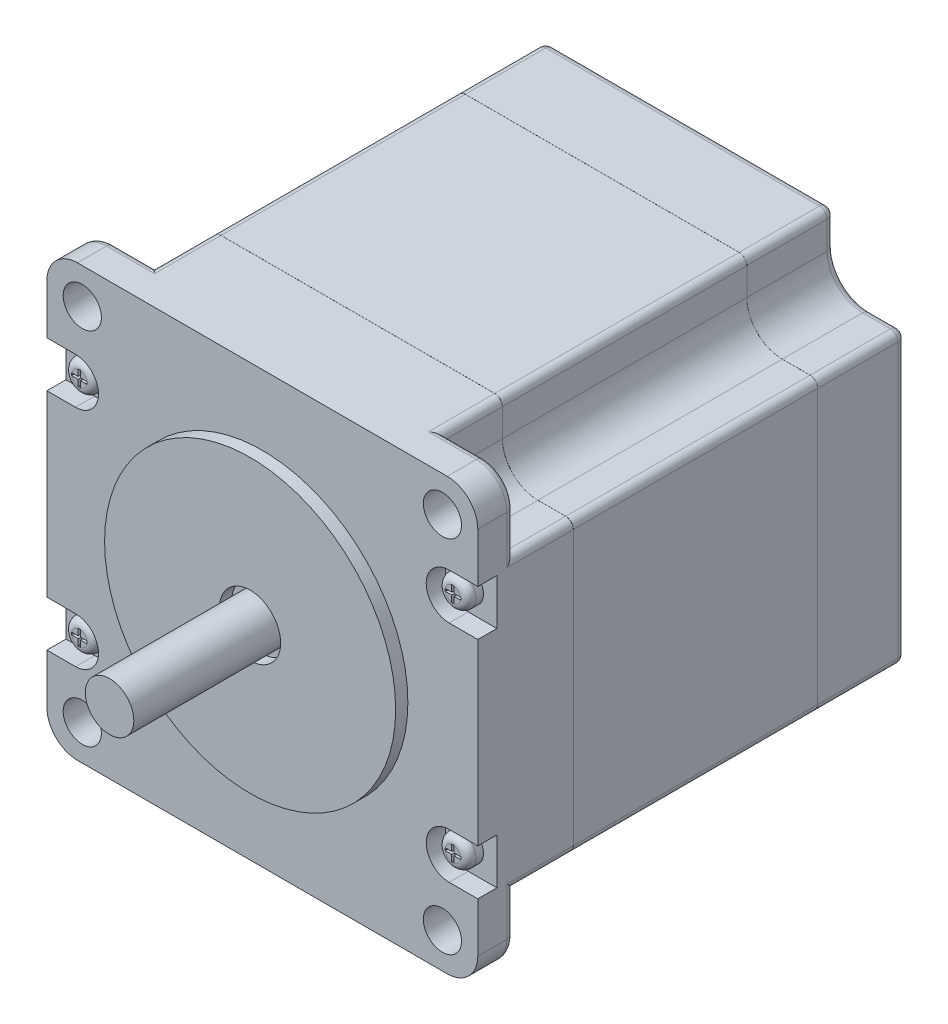
from build123d import *

# Parameters (mm, degrees)
SKETCH1_W             = 56.4
SKETCH1_H             = 56.4
BOSS_EXTRUDE1_DEPTH   = 56
SKETCH2_R             = 19.05
BOSS_EXTRUDE2_DEPTH   = 1.6
SKETCH3_R             = 2.5
CUT_EXTRUDE1_DEPTH    = 10
CUT_EXTRUDE2_DEPTH    = 51.2
FILLET1_R             = 4
SKETCH7_W             = 32
SKETCH7_H             = 56.42
SKETCH7_W_2           = 31.98
SKETCH7_H_2           = 56.4
CUT_EXTRUDE3_DEPTH    = 85.333860341
SKETCH8_R             = 6
CUT_EXTRUDE4_DEPTH    = 3
SKETCH9_R             = 3.175
BOSS_EXTRUDE3_DEPTH   = 1.5
CHAMFER1_SIZE         = 0.5
SKETCH10_R            = 4
CUT_EXTRUDE5_DEPTH    = 1.6
SKETCH11_R            = 3.175
BOSS_EXTRUDE4_DEPTH   = 20
CUT_EXTRUDE7_DEPTH    = 2.5
SKETCH14_R            = 2
BOSS_EXTRUDE5_DEPTH   = 2
BOSS_EXTRUDE5_2_DEPTH = 2
BOSS_EXTRUDE5_3_DEPTH = 2
BOSS_EXTRUDE5_4_DEPTH = 2
FILLET2_R             = 1
FILLET3_R             = 1
FILLET4_R             = 1
FILLET5_R             = 1
CUT_EXTRUDE8_DEPTH    = 1.2
CHAMFER2_SIZE         = 1
CHAMFER3_SIZE         = 1
CHAMFER4_SIZE         = 1
CHAMFER5_SIZE         = 1
FILLET6_R             = 1
FILLET7_R             = 1
FILLET8_R             = 1


with BuildPart() as part:
    # Sketch1 → Boss-Extrude1 (new body)
    with BuildSketch(Plane.XY):
        Rectangle(SKETCH1_W, SKETCH1_H)
    extrude(amount=-BOSS_EXTRUDE1_DEPTH)

    # Sketch2 → Boss-Extrude2 (add)
    with BuildSketch(Plane.XY):
        with Locations(Location((0, 0, 0), (0, 0, 180))):
            Circle(SKETCH2_R)
    extrude(amount=BOSS_EXTRUDE2_DEPTH)

    # Sketch3 → Cut-Extrude1 (cut)
    with BuildSketch(Plane.XY):
        with Locations((-23.57, 23.57)):
            Circle(SKETCH3_R)
        with Locations((23.57, 23.57)):
            Circle(SKETCH3_R)
        with Locations((23.57, -23.57)):
            Circle(SKETCH3_R)
        with Locations((-23.57, -23.57)):
            Circle(SKETCH3_R)
    extrude(amount=-CUT_EXTRUDE1_DEPTH, mode=Mode.SUBTRACT)

    # Sketch6 → Cut-Extrude2 (cut)
    with BuildSketch(Plane(origin=(0, 0, -56), x_dir=(-1, 0, 0), z_dir=(0, 0, -1))):
        with BuildLine():
            Line((-18.92, 23.57), (-18.92, 28.2))
            Line((-18.92, 28.2), (-28.2, 28.2))
            Line((-28.2, 28.2), (-28.2, 18.92))
            Line((-28.2, 18.92), (-23.57, 18.92))
            ThreePointArc((-23.57, 18.92), (-20.281953467, 20.281953467), (-18.92, 23.57))
        make_face()
        with BuildLine():
            Line((28.2, 28.2), (28.2, 18.92))
            Line((28.2, 18.92), (23.57, 18.92))
            ThreePointArc((23.57, 18.92), (20.281953467, 20.281953467), (18.92, 23.57))
            Line((18.92, 23.57), (18.92, 28.2))
            Line((18.92, 28.2), (28.2, 28.2))
        make_face()
        with BuildLine():
            Line((-28.2, -28.2), (-28.2, -18.92))
            Line((-28.2, -18.92), (-23.57, -18.92))
            ThreePointArc((-23.57, -18.92), (-20.281953467, -20.281953467), (-18.92, -23.57))
            Line((-18.92, -23.57), (-18.92, -28.2))
            Line((-18.92, -28.2), (-28.2, -28.2))
        make_face()
        with BuildLine():
            Line((18.92, -23.57), (18.92, -28.2))
            Line((18.92, -28.2), (28.2, -28.2))
            Line((28.2, -28.2), (28.2, -18.92))
            Line((28.2, -18.92), (23.57, -18.92))
            ThreePointArc((23.57, -18.92), (20.281953467, -20.281953467), (18.92, -23.57))
        make_face()
    extrude(amount=-CUT_EXTRUDE2_DEPTH, mode=Mode.SUBTRACT)

    # Fillet1
    fillet1_edges = [part.edges().sort_by_distance(p)[0] for p in [
        (-28.2, 28.2, -2.4),
        (28.2, 28.2, -2.4),
        (28.2, -28.2, -2.4),
        (-28.2, -28.2, -2.4),
    ]]
    fillet(fillet1_edges, radius=FILLET1_R)

    # Sketch7 → Cut-Extrude3 (cut, through all)
    with BuildSketch(Plane.ZY.offset(28.2)):
        with Locations((-28.5, 0)):
            Rectangle(SKETCH7_W, SKETCH7_H)
        with Locations((-28.5, 0)):
            Rectangle(SKETCH7_W_2, SKETCH7_H_2, mode=Mode.SUBTRACT)
    extrude(amount=-CUT_EXTRUDE3_DEPTH, mode=Mode.SUBTRACT)


with BuildPart() as cut_extrude3_piece_1:
    # of the separate pieces the step leaves, piece 1, a body of its own (cut_extrude3_pieces)
    add(part.part.solids().sort_by_distance((-18.92, -28.2, -12.51))[0])

    # Fillet7
    fillet7_edges = [cut_extrude3_piece_1.edges().sort_by_distance(p)[0] for p in [
        (-28.2, -18.92, -28.5),
        (-18.92, 28.2, -28.5),
        (28.2, 18.92, -28.5),
        (18.92, 28.2, -28.5),
        (-28.2, 18.92, -28.5),
        (-18.92, -28.2, -28.5),
        (28.2, -18.92, -28.5),
        (18.92, -28.2, -28.5),
    ]]
    fillet(fillet7_edges, radius=FILLET7_R)


with BuildPart() as cut_extrude3_piece_2:
    # of the separate pieces the step leaves, piece 2, a body of its own (cut_extrude3_pieces)
    add(part.part.solids().sort_by_distance((-24.2, -28.2, 0))[0])

    # Sketch10 → Cut-Extrude5 (cut)
    with BuildSketch(Plane.XY.offset(1.6)):
        Circle(SKETCH10_R)
    extrude(amount=-CUT_EXTRUDE5_DEPTH, mode=Mode.SUBTRACT)

    # Sketch13 → Cut-Extrude7 (cut)
    with BuildSketch(Plane.XY):
        with BuildLine():
            Line((-24.45, 17.7), (-28.2, 17.7))
            Line((-28.2, 17.7), (-28.2, 11.7))
            Line((-28.2, 11.7), (-24.45, 11.7))
            ThreePointArc((-24.45, 11.7), (-21.45, 14.7), (-24.45, 17.7))
        make_face()
        with BuildLine():
            Line((28.2, 11.7), (24.45, 11.7))
            ThreePointArc((24.45, 11.7), (21.45, 14.7), (24.45, 17.7))
            Line((24.45, 17.7), (28.2, 17.7))
            Line((28.2, 17.7), (28.2, 11.7))
        make_face()
        with BuildLine():
            Line((24.45, -17.7), (28.2, -17.7))
            Line((28.2, -17.7), (28.2, -11.7))
            Line((28.2, -11.7), (24.45, -11.7))
            ThreePointArc((24.45, -11.7), (21.45, -14.7), (24.45, -17.7))
        make_face()
        with BuildLine():
            Line((-28.2, -11.7), (-24.45, -11.7))
            ThreePointArc((-24.45, -11.7), (-21.45, -14.7), (-24.45, -17.7))
            Line((-24.45, -17.7), (-28.2, -17.7))
            Line((-28.2, -17.7), (-28.2, -11.7))
        make_face()
    extrude(amount=-CUT_EXTRUDE7_DEPTH, mode=Mode.SUBTRACT)

    # Fillet8
    fillet8_edges = [cut_extrude3_piece_2.edges().sort_by_distance(p)[0] for p in [
        (28.2, 21.56, -4.8),
        (28.2, -21.56, -4.8),
        (28.2, -18.92, -8.65),
        (21.56, -28.2, -4.8),
        (-21.56, -28.2, -4.8),
        (-18.92, -28.2, -8.65),
        (-28.2, -21.56, -4.8),
        (-28.2, 21.56, -4.8),
        (-28.2, 18.92, -8.65),
        (-21.56, 28.2, -4.8),
        (21.56, 28.2, -4.8),
        (18.92, 28.2, -8.65),
        (-27.028427125, 27.028427125, -4.8),
        (-18.92, 28.2, -8.65),
        (27.028427125, 27.028427125, -4.8),
        (28.2, 18.92, -8.65),
        (27.028427125, -27.028427125, -4.8),
        (18.92, -28.2, -8.65),
        (-27.028427125, -27.028427125, -4.8),
        (-28.2, -18.92, -8.65),
    ]]
    fillet(fillet8_edges, radius=FILLET8_R)


with BuildPart() as cut_extrude3_piece_3:
    # of the separate pieces the step leaves, piece 3, a body of its own (cut_extrude3_pieces)
    add(part.part.solids().sort_by_distance((18.92, -28.2, -44.5))[0])

    # Sketch8 → Cut-Extrude4 (cut)
    with BuildSketch(Plane(origin=(0, 0, -56), x_dir=(-1, 0, 0), z_dir=(0, 0, -1))):
        Circle(SKETCH8_R)
    extrude(amount=-CUT_EXTRUDE4_DEPTH, mode=Mode.SUBTRACT)

    # Fillet6
    fillet6_edges = [cut_extrude3_piece_3.edges().sort_by_distance(p)[0] for p in [
        (-18.92, -28.2, -50.25),
        (-28.2, -18.92, -50.25),
        (28.2, -18.92, -50.25),
        (18.92, -28.2, -50.25),
        (18.92, 28.2, -50.25),
        (28.2, 18.92, -50.25),
        (-28.2, 18.92, -50.25),
        (-18.92, 28.2, -50.25),
        (6, 0, -56),
        (-28.2, 0, -56),
        (-20.281953467, 20.281953467, -56),
        (-25.885, 18.92, -56),
        (-18.92, 25.885, -56),
        (0, 28.2, -56),
        (20.281953467, 20.281953467, -56),
        (18.92, 25.885, -56),
        (25.885, 18.92, -56),
        (28.2, 0, -56),
        (20.281953467, -20.281953467, -56),
        (25.885, -18.92, -56),
        (18.92, -25.885, -56),
        (0, -28.2, -56),
        (-20.281953467, -20.281953467, -56),
        (-18.92, -25.885, -56),
        (-25.885, -18.92, -56),
    ]]
    fillet(fillet6_edges, radius=FILLET6_R)


with BuildPart() as body_4:
    # Sketch9 → Boss-Extrude3 (new body)
    with BuildSketch(Plane(origin=(0, 0, -53), x_dir=(-1, 0, 0), z_dir=(0, 0, -1))):
        Circle(SKETCH9_R)
    extrude(amount=BOSS_EXTRUDE3_DEPTH)

    # Chamfer1
    chamfer1_edges = [body_4.edges().sort_by_distance(p)[0] for p in [
        (3.175, 0, -54.5),
    ]]
    chamfer(chamfer1_edges, length=CHAMFER1_SIZE)


with BuildPart() as body_5:
    # Sketch11 → Boss-Extrude4 (new body)
    with BuildSketch(Plane.XY):
        Circle(SKETCH11_R)
    extrude(amount=BOSS_EXTRUDE4_DEPTH)


with BuildPart() as body_6:
    # Sketch14 → Boss-Extrude5 (new body)
    with BuildSketch(Plane.XY.offset(-2.5)):
        with Locations((-24.45, 14.7)):
            Circle(SKETCH14_R)
    extrude(amount=BOSS_EXTRUDE5_DEPTH)

    # Fillet2
    fillet2_edges = [body_6.edges().sort_by_distance(p)[0] for p in [
        (-26.45, 14.7, -0.5),
    ]]
    fillet(fillet2_edges, radius=FILLET2_R)


with BuildPart() as body_7:
    # Sketch14 → Boss-Extrude5 2 (new body)
    with BuildSketch(Plane.XY.offset(-2.5)):
        with Locations((24.45, 14.7)):
            Circle(SKETCH14_R)
    extrude(amount=BOSS_EXTRUDE5_2_DEPTH)

    # Fillet5
    fillet5_edges = [body_7.edges().sort_by_distance(p)[0] for p in [
        (22.45, 14.7, -0.5),
    ]]
    fillet(fillet5_edges, radius=FILLET5_R)


with BuildPart() as body_8:
    # Sketch14 → Boss-Extrude5 3 (new body)
    with BuildSketch(Plane.XY.offset(-2.5)):
        with Locations((24.45, -14.7)):
            Circle(SKETCH14_R)
    extrude(amount=BOSS_EXTRUDE5_3_DEPTH)

    # Fillet4
    fillet4_edges = [body_8.edges().sort_by_distance(p)[0] for p in [
        (22.45, -14.7, -0.5),
    ]]
    fillet(fillet4_edges, radius=FILLET4_R)


with BuildPart() as body_9:
    # Sketch14 → Boss-Extrude5 4 (new body)
    with BuildSketch(Plane.XY.offset(-2.5)):
        with Locations((-24.45, -14.7)):
            Circle(SKETCH14_R)
    extrude(amount=BOSS_EXTRUDE5_4_DEPTH)

    # Fillet3
    fillet3_edges = [body_9.edges().sort_by_distance(p)[0] for p in [
        (-26.45, -14.7, -0.5),
    ]]
    fillet(fillet3_edges, radius=FILLET3_R)


with BuildPart() as cut_extrude8_tool:
    # Sketch15 → Cut-Extrude8 (new body)
    with BuildSketch(Plane.XY.offset(-0.5)):
        Polygon((-24.612256033, 14.862256033), (-24.612256033, 15.718223761), (-24.287743967, 15.718223761), (-24.287743967, 14.862256033), (-23.426787895, 14.862256033), (-23.426787895, 14.537743967), (-24.287743967, 14.537743967), (-24.287743967, 13.681776239), (-24.612256033, 13.681776239), (-24.612256033, 14.537743967), (-25.473212105, 14.537743967), (-25.473212105, 14.862256033), align=None)
        Polygon((24.287743967, 14.862256033), (24.287743967, 15.718223761), (24.612256033, 15.718223761), (24.612256033, 14.862256033), (25.473212105, 14.862256033), (25.473212105, 14.537743967), (24.612256033, 14.537743967), (24.612256033, 13.681776239), (24.287743967, 13.681776239), (24.287743967, 14.537743967), (23.426787895, 14.537743967), (23.426787895, 14.862256033), align=None)
        Polygon((24.612256033, -14.862256033), (24.612256033, -15.718223761), (24.287743967, -15.718223761), (24.287743967, -14.862256033), (23.426787895, -14.862256033), (23.426787895, -14.537743967), (24.287743967, -14.537743967), (24.287743967, -13.681776239), (24.612256033, -13.681776239), (24.612256033, -14.537743967), (25.473212105, -14.537743967), (25.473212105, -14.862256033), align=None)
        Polygon((-24.287743967, -14.862256033), (-24.287743967, -15.718223761), (-24.612256033, -15.718223761), (-24.612256033, -14.862256033), (-25.473212105, -14.862256033), (-25.473212105, -14.537743967), (-24.612256033, -14.537743967), (-24.612256033, -13.681776239), (-24.287743967, -13.681776239), (-24.287743967, -14.537743967), (-23.426787895, -14.537743967), (-23.426787895, -14.862256033), align=None)
    extrude(amount=-CUT_EXTRUDE8_DEPTH)


with BuildPart() as body_6_1:
    add(body_6.part)

    # Cut-Extrude8: cut by cut_extrude8_tool
    add(cut_extrude8_tool.part, mode=Mode.SUBTRACT)

    # Chamfer2
    # the kernel refuses this chamfer: 1 mm, written as the material it adds along each edge
    with BuildSketch(Plane(origin=(-21.716060979, 13.681776239, -1.7), x_dir=(0, -0.027495876610585623, 0.9996219169112968), z_dir=(-1, 0, 0))) as chamfer2_piece_1_section:
        Polygon((CHAMFER2_SIZE * 0.999621916911, CHAMFER2_SIZE * 0.0274958766106), (-CHAMFER2_SIZE * 0.0274958766106, CHAMFER2_SIZE * 0.999621916911), (0, 0), align=None)
    chamfer2_piece_1 = extrude(amount=5.467878041, mode=Mode.PRIVATE)
    chamfer2_piece_1 = split(chamfer2_piece_1, bisect_by=Plane(origin=(-23.426787895, 14.585754725, -1.651989243), z_dir=(-1, 0, 0)), keep=Keep.TOP, mode=Mode.PRIVATE)
    chamfer2_piece_1 = split(chamfer2_piece_1, bisect_by=Plane(origin=(-25.473212105, 14.585754725, -1.651989243), z_dir=(1, 0, 0)), keep=Keep.TOP, mode=Mode.PRIVATE)
    add(chamfer2_piece_1)
    with BuildSketch(Plane(origin=(-23.426787895, 17.433939021, -1.7), x_dir=(0.027495876610585623, 0, 0.9996219169112968), z_dir=(0, -1, 0))) as chamfer2_piece_2_section:
        Polygon((CHAMFER2_SIZE * 0.999621916911, CHAMFER2_SIZE * 0.0274958766106), (-CHAMFER2_SIZE * 0.0274958766106, CHAMFER2_SIZE * 0.999621916911), (0, 0), align=None)
    chamfer2_piece_2 = extrude(amount=5.467878041, mode=Mode.PRIVATE)
    chamfer2_piece_2 = split(chamfer2_piece_2, bisect_by=Plane(origin=(-24.334091943, 15.718223761, -1.653652024), z_dir=(0, -1, 0)), keep=Keep.TOP, mode=Mode.PRIVATE)
    chamfer2_piece_2 = split(chamfer2_piece_2, bisect_by=Plane(origin=(-24.334091943, 13.681776239, -1.653652024), z_dir=(0, 1, 0)), keep=Keep.TOP, mode=Mode.PRIVATE)
    add(chamfer2_piece_2)
    with BuildSketch(Plane(origin=(-25.473212105, 11.966060979, -1.7), x_dir=(-0.027495876610585623, 0, 0.9996219169112968), z_dir=(0, 1, 0))) as chamfer2_piece_3_section:
        Polygon((CHAMFER2_SIZE * 0.999621916911, CHAMFER2_SIZE * 0.0274958766106), (-CHAMFER2_SIZE * 0.0274958766106, CHAMFER2_SIZE * 0.999621916911), (0, 0), align=None)
    chamfer2_piece_3 = extrude(amount=5.467878041, mode=Mode.PRIVATE)
    chamfer2_piece_3 = split(chamfer2_piece_3, bisect_by=Plane(origin=(-24.565908057, 15.718223761, -1.653652024), z_dir=(0, -1, 0)), keep=Keep.TOP, mode=Mode.PRIVATE)
    chamfer2_piece_3 = split(chamfer2_piece_3, bisect_by=Plane(origin=(-24.565908057, 13.681776239, -1.653652024), z_dir=(0, 1, 0)), keep=Keep.TOP, mode=Mode.PRIVATE)
    add(chamfer2_piece_3)
    with BuildSketch(Plane(origin=(-27.183939021, 15.718223761, -1.7), x_dir=(0, 0.027495876610585623, 0.9996219169112968), z_dir=(1, 0, 0))) as chamfer2_piece_4_section:
        Polygon((CHAMFER2_SIZE * 0.999621916911, CHAMFER2_SIZE * 0.0274958766106), (-CHAMFER2_SIZE * 0.0274958766106, CHAMFER2_SIZE * 0.999621916911), (0, 0), align=None)
    chamfer2_piece_4 = extrude(amount=5.467878041, mode=Mode.PRIVATE)
    chamfer2_piece_4 = split(chamfer2_piece_4, bisect_by=Plane(origin=(-23.426787895, 14.814245275, -1.651989243), z_dir=(-1, 0, 0)), keep=Keep.TOP, mode=Mode.PRIVATE)
    chamfer2_piece_4 = split(chamfer2_piece_4, bisect_by=Plane(origin=(-25.473212105, 14.814245275, -1.651989243), z_dir=(1, 0, 0)), keep=Keep.TOP, mode=Mode.PRIVATE)
    add(chamfer2_piece_4)


with BuildPart() as body_7_1:
    add(body_7.part)

    # Cut-Extrude8: cut by cut_extrude8_tool
    add(cut_extrude8_tool.part, mode=Mode.SUBTRACT)

    # Chamfer3
    # the kernel refuses this chamfer: 1 mm, written as the material it adds along each edge
    with BuildSketch(Plane(origin=(25.473212105, 17.433939021, -1.7), x_dir=(0.027495876610585623, 0, 0.9996219169112968), z_dir=(0, -1, 0))) as chamfer3_piece_1_section:
        Polygon((CHAMFER3_SIZE * 0.999621916911, CHAMFER3_SIZE * 0.0274958766106), (-CHAMFER3_SIZE * 0.0274958766106, CHAMFER3_SIZE * 0.999621916911), (0, 0), align=None)
    chamfer3_piece_1 = extrude(amount=5.467878041, mode=Mode.PRIVATE)
    chamfer3_piece_1 = split(chamfer3_piece_1, bisect_by=Plane(origin=(24.565908057, 15.718223761, -1.653652024), z_dir=(0, -1, 0)), keep=Keep.TOP, mode=Mode.PRIVATE)
    chamfer3_piece_1 = split(chamfer3_piece_1, bisect_by=Plane(origin=(24.565908057, 13.681776239, -1.653652024), z_dir=(0, 1, 0)), keep=Keep.TOP, mode=Mode.PRIVATE)
    add(chamfer3_piece_1)
    with BuildSketch(Plane(origin=(21.716060979, 15.718223761, -1.7), x_dir=(0, 0.027495876610585623, 0.9996219169112968), z_dir=(1, 0, 0))) as chamfer3_piece_2_section:
        Polygon((CHAMFER3_SIZE * 0.999621916911, CHAMFER3_SIZE * 0.0274958766106), (-CHAMFER3_SIZE * 0.0274958766106, CHAMFER3_SIZE * 0.999621916911), (0, 0), align=None)
    chamfer3_piece_2 = extrude(amount=5.467878041, mode=Mode.PRIVATE)
    chamfer3_piece_2 = split(chamfer3_piece_2, bisect_by=Plane(origin=(25.473212105, 14.814245275, -1.651989243), z_dir=(-1, 0, 0)), keep=Keep.TOP, mode=Mode.PRIVATE)
    chamfer3_piece_2 = split(chamfer3_piece_2, bisect_by=Plane(origin=(23.426787895, 14.814245275, -1.651989243), z_dir=(1, 0, 0)), keep=Keep.TOP, mode=Mode.PRIVATE)
    add(chamfer3_piece_2)
    with BuildSketch(Plane(origin=(27.183939021, 13.681776239, -1.7), x_dir=(0, -0.027495876610585623, 0.9996219169112968), z_dir=(-1, 0, 0))) as chamfer3_piece_3_section:
        Polygon((CHAMFER3_SIZE * 0.999621916911, CHAMFER3_SIZE * 0.0274958766106), (-CHAMFER3_SIZE * 0.0274958766106, CHAMFER3_SIZE * 0.999621916911), (0, 0), align=None)
    chamfer3_piece_3 = extrude(amount=5.467878041, mode=Mode.PRIVATE)
    chamfer3_piece_3 = split(chamfer3_piece_3, bisect_by=Plane(origin=(25.473212105, 14.585754725, -1.651989243), z_dir=(-1, 0, 0)), keep=Keep.TOP, mode=Mode.PRIVATE)
    chamfer3_piece_3 = split(chamfer3_piece_3, bisect_by=Plane(origin=(23.426787895, 14.585754725, -1.651989243), z_dir=(1, 0, 0)), keep=Keep.TOP, mode=Mode.PRIVATE)
    add(chamfer3_piece_3)
    with BuildSketch(Plane(origin=(23.426787895, 11.966060979, -1.7), x_dir=(-0.027495876610585623, 0, 0.9996219169112968), z_dir=(0, 1, 0))) as chamfer3_piece_4_section:
        Polygon((CHAMFER3_SIZE * 0.999621916911, CHAMFER3_SIZE * 0.0274958766106), (-CHAMFER3_SIZE * 0.0274958766106, CHAMFER3_SIZE * 0.999621916911), (0, 0), align=None)
    chamfer3_piece_4 = extrude(amount=5.467878041, mode=Mode.PRIVATE)
    chamfer3_piece_4 = split(chamfer3_piece_4, bisect_by=Plane(origin=(24.334091943, 15.718223761, -1.653652024), z_dir=(0, -1, 0)), keep=Keep.TOP, mode=Mode.PRIVATE)
    chamfer3_piece_4 = split(chamfer3_piece_4, bisect_by=Plane(origin=(24.334091943, 13.681776239, -1.653652024), z_dir=(0, 1, 0)), keep=Keep.TOP, mode=Mode.PRIVATE)
    add(chamfer3_piece_4)


with BuildPart() as body_8_1:
    add(body_8.part)

    # Cut-Extrude8: cut by cut_extrude8_tool
    add(cut_extrude8_tool.part, mode=Mode.SUBTRACT)

    # Chamfer4
    # the kernel refuses this chamfer: 1 mm, written as the material it adds along each edge
    with BuildSketch(Plane(origin=(21.716060979, -13.681776239, -1.7), x_dir=(0, 0.027495876610585623, 0.9996219169112968), z_dir=(1, 0, 0))) as chamfer4_piece_1_section:
        Polygon((CHAMFER4_SIZE * 0.999621916911, CHAMFER4_SIZE * 0.0274958766106), (-CHAMFER4_SIZE * 0.0274958766106, CHAMFER4_SIZE * 0.999621916911), (0, 0), align=None)
    chamfer4_piece_1 = extrude(amount=5.467878041, mode=Mode.PRIVATE)
    chamfer4_piece_1 = split(chamfer4_piece_1, bisect_by=Plane(origin=(25.473212105, -14.585754725, -1.651989243), z_dir=(-1, 0, 0)), keep=Keep.TOP, mode=Mode.PRIVATE)
    chamfer4_piece_1 = split(chamfer4_piece_1, bisect_by=Plane(origin=(23.426787895, -14.585754725, -1.651989243), z_dir=(1, 0, 0)), keep=Keep.TOP, mode=Mode.PRIVATE)
    add(chamfer4_piece_1)
    with BuildSketch(Plane(origin=(27.183939021, -15.718223761, -1.7), x_dir=(0, -0.027495876610585623, 0.9996219169112968), z_dir=(-1, 0, 0))) as chamfer4_piece_2_section:
        Polygon((CHAMFER4_SIZE * 0.999621916911, CHAMFER4_SIZE * 0.0274958766106), (-CHAMFER4_SIZE * 0.0274958766106, CHAMFER4_SIZE * 0.999621916911), (0, 0), align=None)
    chamfer4_piece_2 = extrude(amount=5.467878041, mode=Mode.PRIVATE)
    chamfer4_piece_2 = split(chamfer4_piece_2, bisect_by=Plane(origin=(25.473212105, -14.814245275, -1.651989243), z_dir=(-1, 0, 0)), keep=Keep.TOP, mode=Mode.PRIVATE)
    chamfer4_piece_2 = split(chamfer4_piece_2, bisect_by=Plane(origin=(23.426787895, -14.814245275, -1.651989243), z_dir=(1, 0, 0)), keep=Keep.TOP, mode=Mode.PRIVATE)
    add(chamfer4_piece_2)
    with BuildSketch(Plane(origin=(23.426787895, -17.433939021, -1.7), x_dir=(-0.027495876610585623, 0, 0.9996219169112968), z_dir=(0, 1, 0))) as chamfer4_piece_3_section:
        Polygon((CHAMFER4_SIZE * 0.999621916911, CHAMFER4_SIZE * 0.0274958766106), (-CHAMFER4_SIZE * 0.0274958766106, CHAMFER4_SIZE * 0.999621916911), (0, 0), align=None)
    chamfer4_piece_3 = extrude(amount=5.467878041, mode=Mode.PRIVATE)
    chamfer4_piece_3 = split(chamfer4_piece_3, bisect_by=Plane(origin=(24.334091943, -13.681776239, -1.653652024), z_dir=(0, -1, 0)), keep=Keep.TOP, mode=Mode.PRIVATE)
    chamfer4_piece_3 = split(chamfer4_piece_3, bisect_by=Plane(origin=(24.334091943, -15.718223761, -1.653652024), z_dir=(0, 1, 0)), keep=Keep.TOP, mode=Mode.PRIVATE)
    add(chamfer4_piece_3)
    with BuildSketch(Plane(origin=(25.473212105, -11.966060979, -1.7), x_dir=(0.027495876610585623, 0, 0.9996219169112968), z_dir=(0, -1, 0))) as chamfer4_piece_4_section:
        Polygon((CHAMFER4_SIZE * 0.999621916911, CHAMFER4_SIZE * 0.0274958766106), (-CHAMFER4_SIZE * 0.0274958766106, CHAMFER4_SIZE * 0.999621916911), (0, 0), align=None)
    chamfer4_piece_4 = extrude(amount=5.467878041, mode=Mode.PRIVATE)
    chamfer4_piece_4 = split(chamfer4_piece_4, bisect_by=Plane(origin=(24.565908057, -13.681776239, -1.653652024), z_dir=(0, -1, 0)), keep=Keep.TOP, mode=Mode.PRIVATE)
    chamfer4_piece_4 = split(chamfer4_piece_4, bisect_by=Plane(origin=(24.565908057, -15.718223761, -1.653652024), z_dir=(0, 1, 0)), keep=Keep.TOP, mode=Mode.PRIVATE)
    add(chamfer4_piece_4)


with BuildPart() as body_9_1:
    add(body_9.part)

    # Cut-Extrude8: cut by cut_extrude8_tool
    add(cut_extrude8_tool.part, mode=Mode.SUBTRACT)

    # Chamfer5
    # the kernel refuses this chamfer: 1 mm, written as the material it adds along each edge
    with BuildSketch(Plane(origin=(-23.426787895, -11.966060979, -1.7), x_dir=(0.027495876610585623, 0, 0.9996219169112968), z_dir=(0, -1, 0))) as chamfer5_piece_1_section:
        Polygon((CHAMFER5_SIZE * 0.999621916911, CHAMFER5_SIZE * 0.0274958766106), (-CHAMFER5_SIZE * 0.0274958766106, CHAMFER5_SIZE * 0.999621916911), (0, 0), align=None)
    chamfer5_piece_1 = extrude(amount=5.467878041, mode=Mode.PRIVATE)
    chamfer5_piece_1 = split(chamfer5_piece_1, bisect_by=Plane(origin=(-24.334091943, -13.681776239, -1.653652024), z_dir=(0, -1, 0)), keep=Keep.TOP, mode=Mode.PRIVATE)
    chamfer5_piece_1 = split(chamfer5_piece_1, bisect_by=Plane(origin=(-24.334091943, -15.718223761, -1.653652024), z_dir=(0, 1, 0)), keep=Keep.TOP, mode=Mode.PRIVATE)
    add(chamfer5_piece_1)
    with BuildSketch(Plane(origin=(-25.473212105, -17.433939021, -1.7), x_dir=(-0.027495876610585623, 0, 0.9996219169112968), z_dir=(0, 1, 0))) as chamfer5_piece_2_section:
        Polygon((CHAMFER5_SIZE * 0.999621916911, CHAMFER5_SIZE * 0.0274958766106), (-CHAMFER5_SIZE * 0.0274958766106, CHAMFER5_SIZE * 0.999621916911), (0, 0), align=None)
    chamfer5_piece_2 = extrude(amount=5.467878041, mode=Mode.PRIVATE)
    chamfer5_piece_2 = split(chamfer5_piece_2, bisect_by=Plane(origin=(-24.565908057, -13.681776239, -1.653652024), z_dir=(0, -1, 0)), keep=Keep.TOP, mode=Mode.PRIVATE)
    chamfer5_piece_2 = split(chamfer5_piece_2, bisect_by=Plane(origin=(-24.565908057, -15.718223761, -1.653652024), z_dir=(0, 1, 0)), keep=Keep.TOP, mode=Mode.PRIVATE)
    add(chamfer5_piece_2)
    with BuildSketch(Plane(origin=(-21.716060979, -15.718223761, -1.7), x_dir=(0, -0.027495876610585623, 0.9996219169112968), z_dir=(-1, 0, 0))) as chamfer5_piece_3_section:
        Polygon((CHAMFER5_SIZE * 0.999621916911, CHAMFER5_SIZE * 0.0274958766106), (-CHAMFER5_SIZE * 0.0274958766106, CHAMFER5_SIZE * 0.999621916911), (0, 0), align=None)
    chamfer5_piece_3 = extrude(amount=5.467878041, mode=Mode.PRIVATE)
    chamfer5_piece_3 = split(chamfer5_piece_3, bisect_by=Plane(origin=(-23.426787895, -14.814245275, -1.651989243), z_dir=(-1, 0, 0)), keep=Keep.TOP, mode=Mode.PRIVATE)
    chamfer5_piece_3 = split(chamfer5_piece_3, bisect_by=Plane(origin=(-25.473212105, -14.814245275, -1.651989243), z_dir=(1, 0, 0)), keep=Keep.TOP, mode=Mode.PRIVATE)
    add(chamfer5_piece_3)
    with BuildSketch(Plane(origin=(-27.183939021, -13.681776239, -1.7), x_dir=(0, 0.027495876610585623, 0.9996219169112968), z_dir=(1, 0, 0))) as chamfer5_piece_4_section:
        Polygon((CHAMFER5_SIZE * 0.999621916911, CHAMFER5_SIZE * 0.0274958766106), (-CHAMFER5_SIZE * 0.0274958766106, CHAMFER5_SIZE * 0.999621916911), (0, 0), align=None)
    chamfer5_piece_4 = extrude(amount=5.467878041, mode=Mode.PRIVATE)
    chamfer5_piece_4 = split(chamfer5_piece_4, bisect_by=Plane(origin=(-23.426787895, -14.585754725, -1.651989243), z_dir=(-1, 0, 0)), keep=Keep.TOP, mode=Mode.PRIVATE)
    chamfer5_piece_4 = split(chamfer5_piece_4, bisect_by=Plane(origin=(-25.473212105, -14.585754725, -1.651989243), z_dir=(1, 0, 0)), keep=Keep.TOP, mode=Mode.PRIVATE)
    add(chamfer5_piece_4)


solid = Compound([cut_extrude3_piece_1.part, cut_extrude3_piece_2.part, cut_extrude3_piece_3.part, body_4.part, body_5.part, body_6_1.part, body_7_1.part, body_8_1.part, body_9_1.part])
